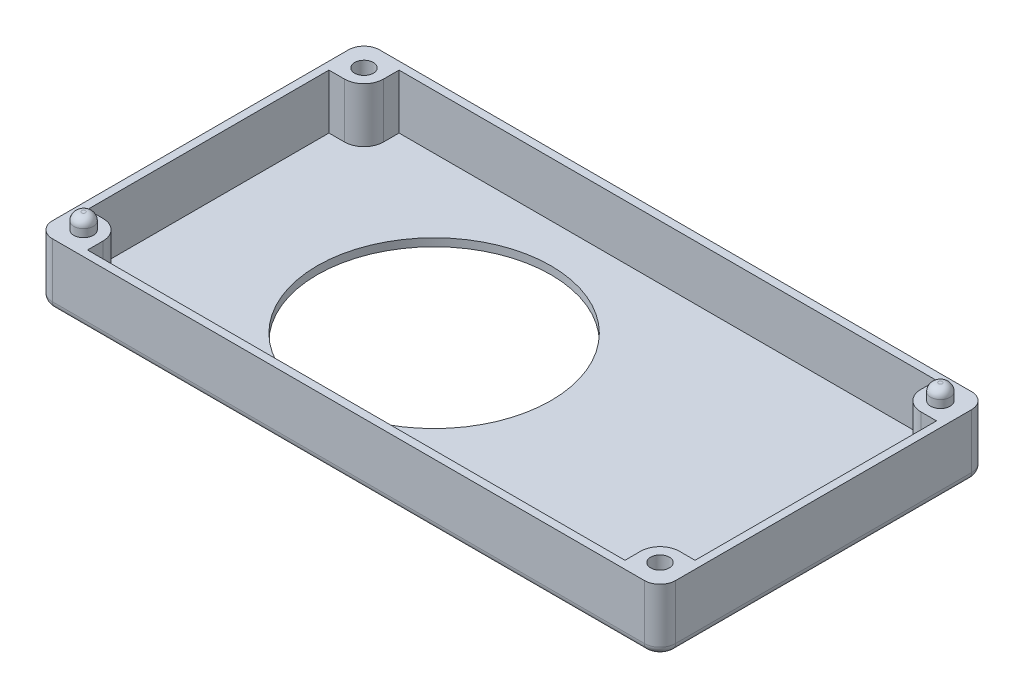
from build123d import *

# Parameters (mm, degrees)
SKETCH1_W                                = 80
SKETCH1_H                                = 42
BOSS_EXTRUDE1_DEPTH                      = 8
SKETCH2_W                                = 78
SKETCH2_H                                = 40
CUT_EXTRUDE1_DEPTH                       = 7
FILLET1_R                                = 2
BOSS_EXTRUDE2_REACH                      = 47.88
MIRROR1_AT_THE_SECOND_PLANE_COPY_1_REACH = 47.88
M2_CLEARANCE_HOLE2_D                     = 2.4
SKETCH9_R                                = 2
CUT_EXTRUDE2_DEPTH                       = 2.5
SKETCH11_R                               = 1.25
BOSS_EXTRUDE3_DEPTH                      = 2
FILLET2_R                                = 1
FILLET3_R                                = 1
CUT_EXTRUDE3_REACH                       = 48.271
SKETCH12_R                               = 15


with BuildPart() as part:
    # Sketch1 → Boss-Extrude1 (new body)
    with BuildSketch(Plane(origin=(0, 0, 0), x_dir=(1, 0, 0), z_dir=(0, 1, 0))):
        Rectangle(SKETCH1_W, SKETCH1_H)
    extrude(amount=BOSS_EXTRUDE1_DEPTH)

    # Sketch2 → Cut-Extrude1 (cut)
    with BuildSketch(Plane(origin=(0, 8, 0), x_dir=(1, 0, 0), z_dir=(0, 1, 0))):
        Rectangle(SKETCH2_W, SKETCH2_H)
    extrude(amount=-CUT_EXTRUDE1_DEPTH, mode=Mode.SUBTRACT)

    # Fillet1
    fillet1_edges = [part.edges().sort_by_distance(p)[0] for p in [
        (-39, 4.5, -20),
        (-39, 4.5, 20),
        (39, 4.5, 20),
        (39, 4.5, -20),
        (40, 4, 21),
        (-40, 4, 21),
        (-40, 4, -21),
        (40, 4, -21),
    ]]
    fillet(fillet1_edges, radius=FILLET1_R)

    # Sketch3 → Boss-Extrude2 (add, up to next)
    with BuildSketch(Plane(origin=(0, 8, 0), x_dir=(1, 0, 0), z_dir=(0, 1, 0)), mode=Mode.PRIVATE) as boss_extrude2_sk1:
        with BuildLine():
            Line((-34.5, 18), (-34.5, 20))
            Line((-34.5, 20), (-37, 20))
            ThreePointArc((-37, 20), (-38.414213562, 19.414213562), (-39, 18))
            Line((-39, 18), (-39, 15.5))
            Line((-39, 15.5), (-37, 15.5))
            ThreePointArc((-37, 15.5), (-35.232233047, 16.232233047), (-34.5, 18))
        make_face()
    boss_extrude2_tool1 = extrude(boss_extrude2_sk1.sketch, amount=-BOSS_EXTRUDE2_REACH, mode=Mode.PRIVATE) - part.part
    boss_extrude2 = boss_extrude2_tool1.solids().sort_by_distance((-36.789939, 8, -17.789939))[0]
    add(boss_extrude2)

    # Mirror1: Boss-Extrude2 across plane
    add(boss_extrude2.mirror(Plane.XY))

    # Mirror1 at the second plane: Boss-Extrude2 across plane
    add(boss_extrude2.mirror(Plane(origin=(0, 0, 0), x_dir=(0, 0, 1), z_dir=(1, 0, 0))))

    # Mirror1 at the second plane copy 1 sketc → Mirror1 at the second plane copy 1 (add, up to next)
    with BuildSketch(Plane(origin=(0, 8, 0), x_dir=(-1, 0, 0), z_dir=(0, 1, 0)), mode=Mode.PRIVATE) as mirror1_at_the_second_plane_copy_1_sk1:
        with BuildLine():
            Line((-34.5, 18), (-34.5, 20))
            Line((-34.5, 20), (-37, 20))
            ThreePointArc((-37, 20), (-38.414213562, 19.414213562), (-39, 18))
            Line((-39, 18), (-39, 15.5))
            Line((-39, 15.5), (-37, 15.5))
            ThreePointArc((-37, 15.5), (-35.232233047, 16.232233047), (-34.5, 18))
        make_face()
    mirror1_at_the_second_plane_copy_1_tool1 = extrude(mirror1_at_the_second_plane_copy_1_sk1.sketch, amount=-MIRROR1_AT_THE_SECOND_PLANE_COPY_1_REACH, mode=Mode.PRIVATE) - part.part
    add(mirror1_at_the_second_plane_copy_1_tool1.solids().sort_by_distance((36.789939, 8, 17.789939))[0])

    # M2 Clearance Hole2 (through all)
    with Locations(Plane(origin=(-37, 8, -18), x_dir=(0, 0, 1), z_dir=(0, 1, 0))):
        with Locations((0, 0), (36, 74)):
            Hole(M2_CLEARANCE_HOLE2_D / 2)

    # Sketch9 → Cut-Extrude2 (cut)
    with BuildSketch(Plane.XZ):
        with Locations(Location((-37, -18, 0), (0, 0, 270))):
            Circle(SKETCH9_R)
        with Locations(Location((37, 18, 0), (0, 0, 270))):
            Circle(SKETCH9_R)
    extrude(amount=-CUT_EXTRUDE2_DEPTH, mode=Mode.SUBTRACT)

    # Sketch11 → Boss-Extrude3 (add)
    with BuildSketch(Plane(origin=(0, 8, 0), x_dir=(1, 0, 0), z_dir=(0, 1, 0))):
        with Locations(Location((-37, -18, 0), (0, 0, 90))):
            Circle(SKETCH11_R)
        with Locations(Location((37, 18, 0), (0, 0, 90))):
            Circle(SKETCH11_R)
    extrude(amount=BOSS_EXTRUDE3_DEPTH)

    # Fillet2
    fillet2_edges = [part.edges().sort_by_distance(p)[0] for p in [
        (-37, 10, 19.25),
        (37, 10, -16.75),
    ]]
    fillet(fillet2_edges, radius=FILLET2_R)

    # Fillet3
    fillet3_edges = [part.edges().sort_by_distance(p)[0] for p in [
        (0, 0, -21),
        (40, 0, 0),
        (0, 0, 21),
        (-40, 0, 0),
        (-39.414213562, 0, -20.414213562),
        (-39.414213562, 0, 20.414213562),
        (39.414213562, 0, 20.414213562),
        (39.414213562, 0, -20.414213562),
    ]]
    fillet(fillet3_edges, radius=FILLET3_R - 0.0001)  # a hair under: the kernel refuses the full size

    # Sketch12 → Cut-Extrude3 (cut, up to next)
    with BuildSketch(Plane.XZ, mode=Mode.PRIVATE) as cut_extrude3_sk1:
        with Locations(Location((-10, 0, 0), (0, 0, 270))):
            Circle(SKETCH12_R)
    cut_extrude3_tool1 = extrude(cut_extrude3_sk1.sketch, amount=-CUT_EXTRUDE3_REACH, mode=Mode.PRIVATE) & part.part
    add(cut_extrude3_tool1.solids().sort_by_distance((-10, 0, 0))[0], mode=Mode.SUBTRACT)


solid = part.part
